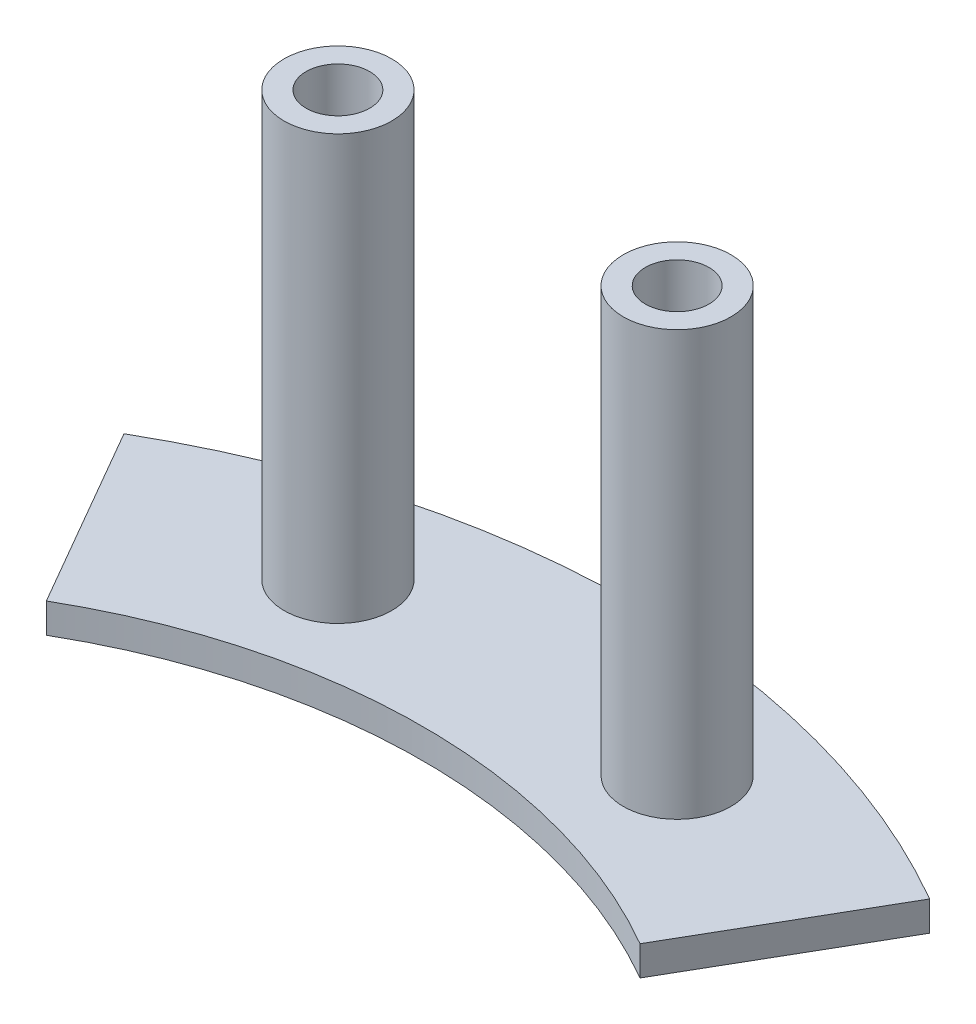
from build123d import *

# Parameters (mm, degrees)
BOSS_EXTRUDE1_DEPTH = 1.4
SKETCH2_R           = 2.54
BOSS_EXTRUDE2_DEPTH = 20
SKETCH5_R           = 1.5
CUT_EXTRUDE1_DEPTH  = 3


with BuildPart() as part:
    # Sketch1 → Boss-Extrude1 (new body)
    with BuildSketch(Plane(origin=(0, 0, 0), x_dir=(1, 0, 0), z_dir=(0, 1, 0))):
        with BuildLine():
            Line((-19, 32.908965344), (-14, 24.248711306))
            ThreePointArc((-14, 24.248711306), (0, 28), (14, 24.248711306))
            Line((14, 24.248711306), (19, 32.908965344))
            ThreePointArc((19, 32.908965344), (0, 38), (-19, 32.908965344))
        make_face()
    extrude(amount=BOSS_EXTRUDE1_DEPTH)

    # Sketch2 → Boss-Extrude2 (add)
    with BuildSketch(Plane(origin=(0, 1.4, 0), x_dir=(1, 0, 0), z_dir=(0, 1, 0))):
        with Locations((-8, 32)):
            Circle(SKETCH2_R)
        with Locations((8, 32)):
            Circle(SKETCH2_R)
    extrude(amount=BOSS_EXTRUDE2_DEPTH)

    # Sketch5 → Cut-Extrude1 (cut)
    with BuildSketch(Plane(origin=(0, 21.4, 0), x_dir=(1, 0, 0), z_dir=(0, 1, 0))):
        with Locations((-8, 32)):
            Circle(SKETCH5_R)
        with Locations((8, 32)):
            Circle(SKETCH5_R)
    extrude(amount=-CUT_EXTRUDE1_DEPTH, mode=Mode.SUBTRACT)


solid = part.part
